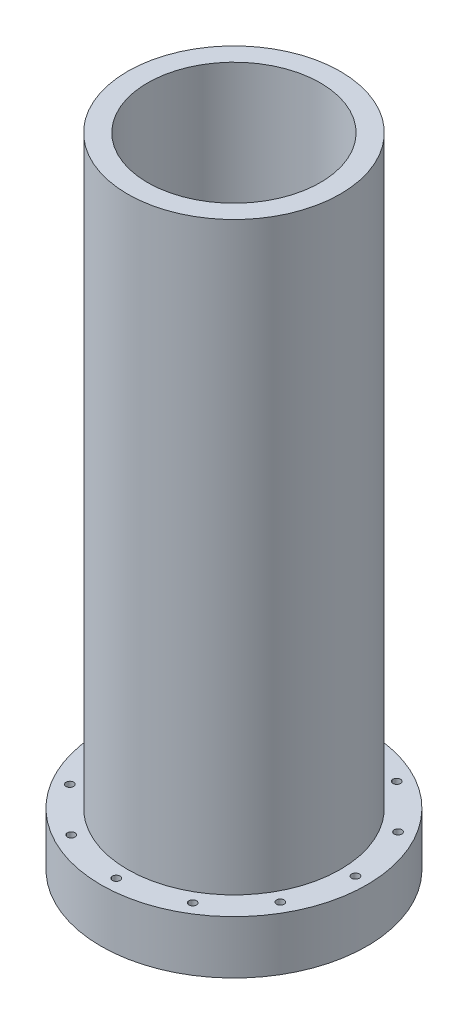
from build123d import *

# Parameters (mm, degrees)
SKETCH2_R               = 50.8
SKETCH2_R_2             = 41.275
BOSS_EXTRUDE1_DEPTH     = 304.8
SKETCH4_R               = 63.5
SKETCH4_R_2             = 44.45
BOSS_EXTRUDE3_DEPTH     = 25.4
CUT_EXTRUDE1_DEPTH      = 294.477188211
CUT_EXTRUDE1_DEPTH_BACK = 294.477188211
SKETCH5_R               = 1.814679062


with BuildPart() as part:
    # Sketch2 → Boss-Extrude1 (new body)
    with BuildSketch(Plane(origin=(0, 0, 0), x_dir=(1, 0, 0), z_dir=(0, 1, 0))):
        Circle(SKETCH2_R)
        Circle(SKETCH2_R_2, mode=Mode.SUBTRACT)
    extrude(amount=BOSS_EXTRUDE1_DEPTH)

    # Sketch4 → Boss-Extrude3 (add)
    with BuildSketch(Plane(origin=(0, 0, 0), x_dir=(1, 0, 0), z_dir=(0, 1, 0))):
        Circle(SKETCH4_R)
        Circle(SKETCH4_R_2, mode=Mode.SUBTRACT)
    extrude(amount=BOSS_EXTRUDE3_DEPTH)

    # Sketch5 → Cut-Extrude1 (cut, two sides: drawn at the far end of the back side and taken through both)
    with BuildSketch(Plane(origin=(0, 25.4, 0), x_dir=(1, 0, 0), z_dir=(0, 1, 0)).offset(-CUT_EXTRUDE1_DEPTH_BACK)):
        with Locations((29.354015513, -49.035336985)):
            Circle(SKETCH5_R)
        with Locations((0.903654645, -57.142855269)):
            Circle(SKETCH5_R)
        with Locations((-27.788839756, -49.93899163)):
            Circle(SKETCH5_R)
        with Locations((-49.035336985, -29.354015513)):
            Circle(SKETCH5_R)
        with Locations((-57.142855269, -0.903654645)):
            Circle(SKETCH5_R)
        with Locations((-49.93899163, 27.788839756)):
            Circle(SKETCH5_R)
        with Locations((-29.354015513, 49.035336985)):
            Circle(SKETCH5_R)
        with Locations((-0.903654645, 57.142855269)):
            Circle(SKETCH5_R)
        with Locations((27.788839756, 49.93899163)):
            Circle(SKETCH5_R)
        with Locations((49.035336985, 29.354015513)):
            Circle(SKETCH5_R)
        with Locations((57.142855269, 0.903654645)):
            Circle(SKETCH5_R)
        with Locations((49.93899163, -27.788839756)):
            Circle(SKETCH5_R)
    extrude(amount=CUT_EXTRUDE1_DEPTH + CUT_EXTRUDE1_DEPTH_BACK, mode=Mode.SUBTRACT)


solid = part.part
